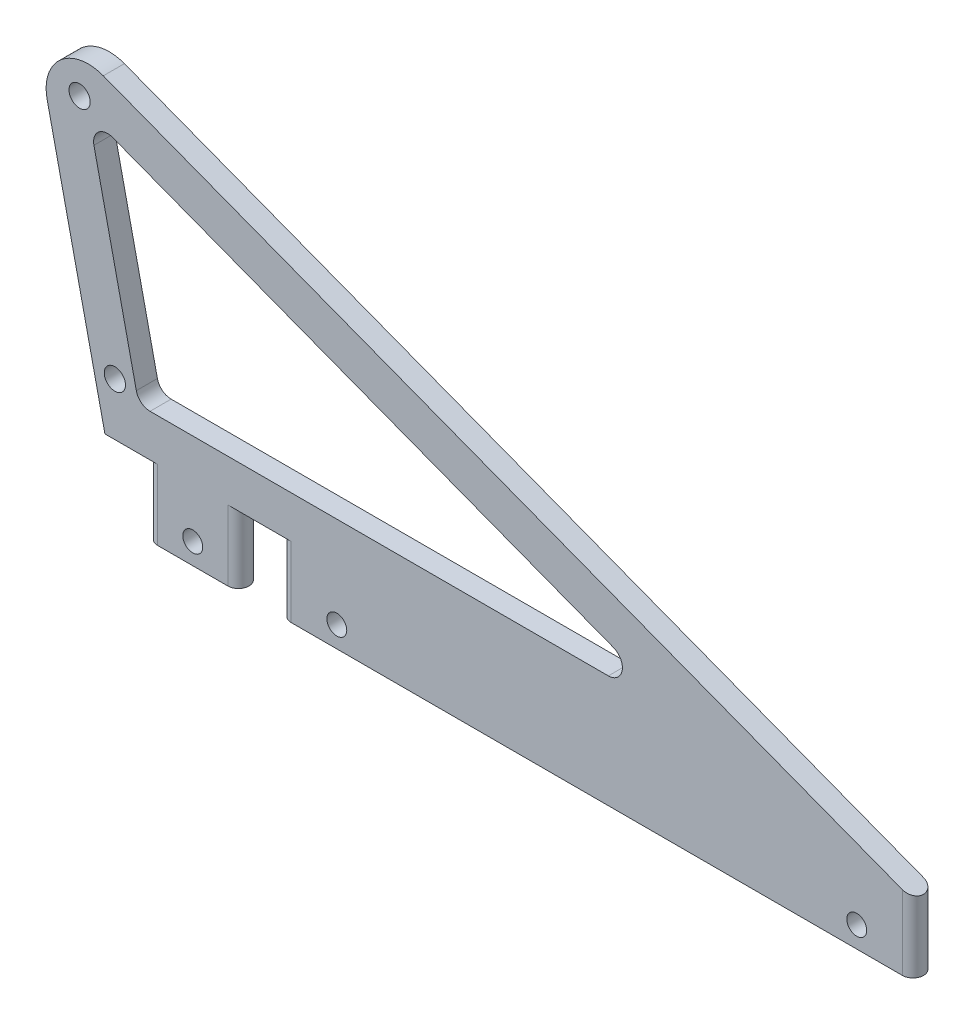
from build123d import *

# Parameters (mm, degrees)
BOSS_EXTRUDE1_DEPTH         = 4.7625
CUT_EXTRUDE1_DEPTH          = 198.884278841
FILLET1_R                   = 3.175
FILLET2_R                   = 9.525
F_12_0_189_DIAMETER_HOLE1_D = 4.8006
F_8_CLEARANCE_HOLE1_D       = 4.4958
FILLET3_RADIUS              = 2.38125
FILLET3_LENGTH              = 15.875
FILLET4_RADIUS              = 2.38125
FILLET4_LENGTH              = 15.875
FILLET5_RADIUS              = 2.38125
FILLET5_LENGTH              = 15.875
FILLET6_START               = -17
FILLET6_DEPTH               = 19


with BuildPart() as part:
    # Sketch1 → Boss-Extrude1 (new body)
    with BuildSketch(Plane.XY):
        Polygon((0, 0), (9.525, 0), (9.525, -15.875), (30.1625, -15.875), (30.1625, 0), (39.6875, 0), (39.6875, -15.875), (182.5625, -15.875), (182.5625, 0), (-16.893133293, 76.2), align=None)
    extrude(amount=BOSS_EXTRUDE1_DEPTH)

    # Sketch2 → Cut-Extrude1 (cut, through all)
    with BuildSketch(Plane.XY.offset(4.7625)):
        Polygon((7.644620712, 9.525), (130.941072945, 9.525), (-3.76442223, 60.987867019), align=None)
    extrude(amount=-CUT_EXTRUDE1_DEPTH, mode=Mode.SUBTRACT)

    # Fillet1
    fillet1_edges = [part.edges().sort_by_distance(p)[0] for p in [
        (7.644620712, 9.525, 2.38125),
        (-3.76442223, 60.987867019, 2.38125),
        (130.941072945, 9.525, 2.38125),
    ]]
    fillet(fillet1_edges, radius=FILLET1_R)

    # Fillet2
    fillet2_edges = [part.edges().sort_by_distance(p)[0] for p in [
        (-16.893133293, 76.2, 2.38125),
    ]]
    fillet(fillet2_edges, radius=FILLET2_R)

    # #12 (0.189) Diameter Hole1 (through all)
    with Locations(Plane.XY.offset(4.7625)):
        with Locations((-5.72515333, 63.259750533), (2.244424524, 11.879883041)):
            Hole(F_12_0_189_DIAMETER_HOLE1_D / 2)

    # #8 Clearance Hole1 (through all)
    with Locations(Plane.XY.offset(4.7625)):
        with Locations((19.84375, -11.1125), (52.3875, -11.1125), (169.8625, -11.1125)):
            Hole(F_8_CLEARANCE_HOLE1_D / 2)

    # Fillet3: full round fillet: the end face becomes a half cylinder, R = half its width
    fillet3_face = Plane((9.525, -7.9375, 2.38125), x_dir=(0, 1, 0), z_dir=(-1, 0, 0))  # on the end face: x along it, z out of the body
    fillet3_slab = fillet3_face.offset(-FILLET3_RADIUS / 2) * Box(FILLET3_LENGTH, 2 * FILLET3_RADIUS, FILLET3_RADIUS, mode=Mode.PRIVATE)  # the body's end, R deep
    fillet3_round = Plane((11.90625, -7.9375, 2.38125), x_dir=(-1, 0, 0), z_dir=(0, 1, 0)) * Cylinder(FILLET3_RADIUS, FILLET3_LENGTH, mode=Mode.PRIVATE)  # its axis R under the face
    add(fillet3_slab - fillet3_round, mode=Mode.SUBTRACT)

    # Fillet4: full round fillet: the end face becomes a half cylinder, R = half its width
    fillet4_face = Plane((30.1625, -7.9375, 2.38125), x_dir=(0, 1, 0), z_dir=(1, 0, 0))  # on the end face: x along it, z out of the body
    fillet4_slab = fillet4_face.offset(-FILLET4_RADIUS / 2) * Box(FILLET4_LENGTH, 2 * FILLET4_RADIUS, FILLET4_RADIUS, mode=Mode.PRIVATE)  # the body's end, R deep
    fillet4_round = Plane((27.78125, -7.9375, 2.38125), x_dir=(1, 0, 0), z_dir=(0, 1, 0)) * Cylinder(FILLET4_RADIUS, FILLET4_LENGTH, mode=Mode.PRIVATE)  # its axis R under the face
    add(fillet4_slab - fillet4_round, mode=Mode.SUBTRACT)

    # Fillet5: full round fillet: the end face becomes a half cylinder, R = half its width
    fillet5_face = Plane((39.6875, -7.9375, 2.38125), x_dir=(0, -1, 0), z_dir=(-1, 0, 0))  # on the end face: x along it, z out of the body
    fillet5_slab = fillet5_face.offset(-FILLET5_RADIUS / 2) * Box(FILLET5_LENGTH, 2 * FILLET5_RADIUS, FILLET5_RADIUS, mode=Mode.PRIVATE)  # the body's end, R deep
    fillet5_round = Plane((42.06875, -7.9375, 2.38125), x_dir=(-1, 0, 0), z_dir=(0, -1, 0)) * Cylinder(FILLET5_RADIUS, FILLET5_LENGTH, mode=Mode.PRIVATE)  # its axis R under the face
    add(fillet5_slab - fillet5_round, mode=Mode.SUBTRACT)

    # Fillet6: read off the stored shape, not the designer's step
    # Fillet6 outline → Fillet6 (cut)
    with BuildSketch(Plane(origin=(0, 0, 0), x_dir=(1, 0, 0), z_dir=(0, 1, 0)).offset(FILLET6_START)):
        with BuildLine():
            ThreePointArc((180.18125, 0), (181.865048023, -0.697451977), (182.5625, -2.38125))
            Line((182.5625, -2.38125), (182.5625, 0))
            Line((182.5625, 0), (180.18125, 0))
        make_face()
        with BuildLine():
            ThreePointArc((182.5625, -2.38125), (181.865048023, -4.065048023), (180.18125, -4.7625))
            Line((180.18125, -4.7625), (182.5625, -4.7625))
            Line((182.5625, -4.7625), (182.5625, -2.38125))
        make_face()
    extrude(amount=FILLET6_DEPTH, mode=Mode.SUBTRACT)


solid = part.part
